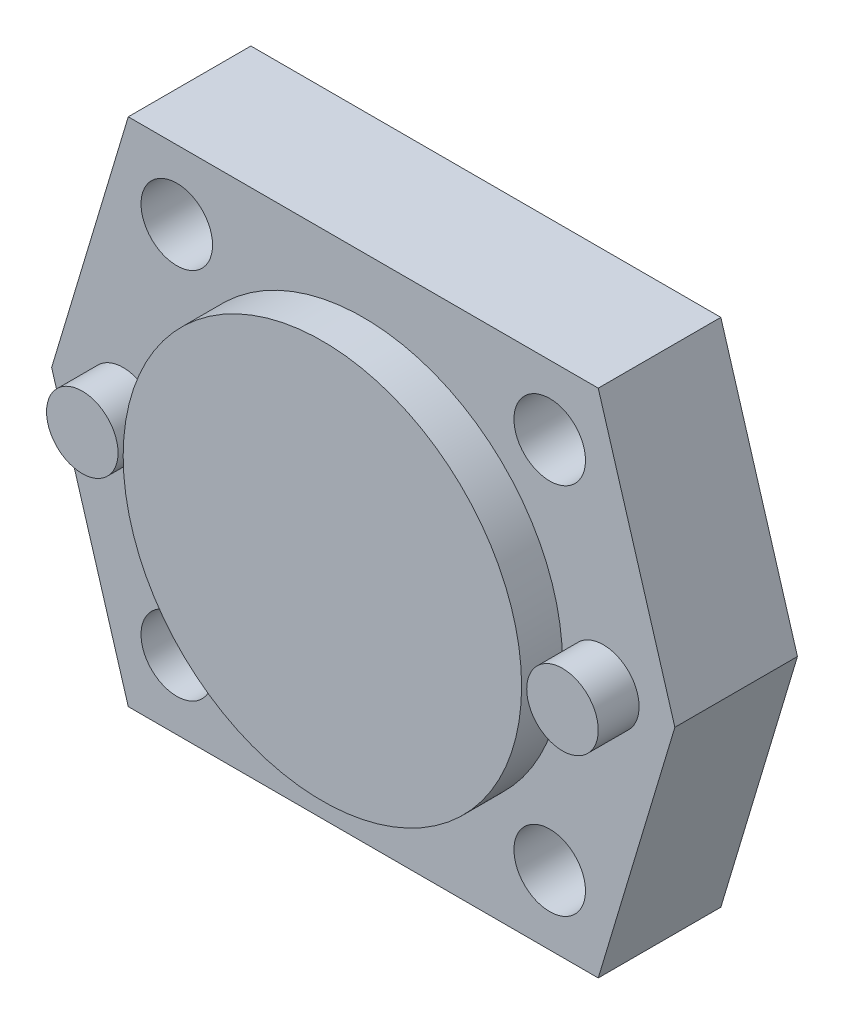
from build123d import *

# Parameters (mm, degrees)
BOSS_EXTRUDE1_DEPTH = 12
SKETCH2_R           = 19.5
SKETCH2_R_2         = 3.5
BOSS_EXTRUDE2_DEPTH = 4
SKETCH3_R           = 3.5
CUT_EXTRUDE1_DEPTH  = 12


with BuildPart() as part:
    # Sketch1 → Boss-Extrude1 (new body)
    with BuildSketch(Plane.XY):
        Polygon((-23, 25), (23, 25), (30.5, 0), (23, -25), (-23, -25), (-30.5, 0), align=None)
    extrude(amount=BOSS_EXTRUDE1_DEPTH)

    # Sketch2 → Boss-Extrude2 (add)
    with BuildSketch(Plane.XY.offset(12)):
        Circle(SKETCH2_R)
        with Locations((23.5, 0)):
            Circle(SKETCH2_R_2)
        with Locations((-23.5, 0)):
            Circle(SKETCH2_R_2)
    extrude(amount=BOSS_EXTRUDE2_DEPTH)

    # Sketch3 → Cut-Extrude1 (cut)
    with BuildSketch(Plane.XY.offset(12)):
        with Locations((18.25, 18.25)):
            Circle(SKETCH3_R)
        with Locations((18.25, -18.25)):
            Circle(SKETCH3_R)
        with Locations((-18.25, -18.25)):
            Circle(SKETCH3_R)
        with Locations((-18.25, 18.25)):
            Circle(SKETCH3_R)
    extrude(amount=-CUT_EXTRUDE1_DEPTH, mode=Mode.SUBTRACT)


solid = part.part
